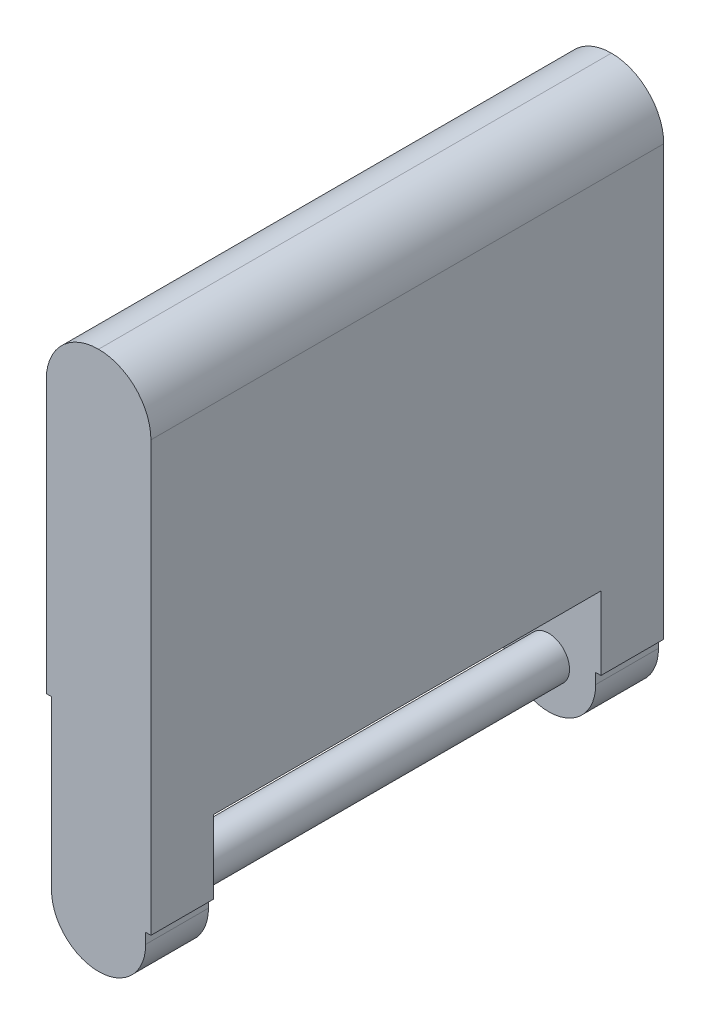
from build123d import *

# Parameters (mm, degrees)
BOSS_EXTRUDE1_DEPTH    = 49
FILLET1_R              = 5
CUT_EXTRUDE1_START     = -2.282608696
CUT_EXTRUDE1_OUTLINE_W = 10
CUT_EXTRUDE1_OUTLINE_H = 37
CUT_EXTRUDE1_DEPTH     = 13
SKETCH6_R              = 2
BOSS_EXTRUDE2_DEPTH    = 37
CUT_EXTRUDE2_DEPTH     = 49


# Read off the part's stored shape, not the designer's step: Cut-Extrude1
with BuildPart() as part:
    # Sketch3 → Boss-Extrude1 (new body)
    with BuildSketch(Plane.XY.offset(24.5)):
        Polygon((-5, -2.282608696), (0, -2.282608696), (5, -2.282608696), (5, 49.717391304), (-5, 49.717391304), align=None)
    extrude(amount=-BOSS_EXTRUDE1_DEPTH)

    # Fillet1
    fillet1_edges = [part.edges().sort_by_distance(p)[0] for p in [
        (5, -2.282608696, 0),
        (-5, -2.282608696, 0),
        (5, 49.717391304, 0),
        (-5, 49.717391304, 0),
    ]]
    fillet(fillet1_edges, radius=FILLET1_R - 0.0001)  # a hair under: the kernel refuses the full size

    # Cut-Extrude1 outline → Cut-Extrude1 (cut)
    with BuildSketch(Plane(origin=(0, 0, 0), x_dir=(1, 0, 0), z_dir=(0, 1, 0)).offset(CUT_EXTRUDE1_START)):
        Rectangle(CUT_EXTRUDE1_OUTLINE_W, CUT_EXTRUDE1_OUTLINE_H)
    extrude(amount=CUT_EXTRUDE1_DEPTH, mode=Mode.SUBTRACT)

    # Sketch6 → Boss-Extrude2 (add)
    with BuildSketch(Plane.XY.offset(-18.5)):
        with Locations((0, 2.717391304)):
            Circle(SKETCH6_R)
    extrude(amount=BOSS_EXTRUDE2_DEPTH)

    # Sketch7 → Cut-Extrude2 (cut)
    with BuildSketch(Plane.XY.offset(24.5)):
        with BuildLine():
            Line((4.5, 3.717391304), (5, 3.717391304))
            Line((5, 3.717391304), (5, 2.717391304))
            ThreePointArc((5, 2.717391304), (3.535533906, -0.818142602), (0, -2.282608696))
            ThreePointArc((0, -2.282608696), (-3.535533906, -0.818142602), (-5, 2.717391304))
            Line((-5, 2.717391304), (-5, 18.717391304))
            Line((-5, 18.717391304), (-4.5, 18.717391304))
            Line((-4.5, 18.717391304), (-4.5, 2.717391304))
            ThreePointArc((-4.5, 2.717391304), (-3.181980515, -0.464589211), (0, -1.782608696))
            ThreePointArc((0, -1.782608696), (3.181980515, -0.464589211), (4.5, 2.717391304))
            Line((4.5, 2.717391304), (4.5, 3.717391304))
        make_face()
    extrude(amount=-CUT_EXTRUDE2_DEPTH, mode=Mode.SUBTRACT)


with BuildPart() as cut_extrude2_kept_piece:
    # of the separate pieces the step leaves, the one the design keeps (cut_extrude2_pieces_kept)
    add(part.part.solids().sort_by_distance((4.5, 3.717391304, -18.5))[0])


solid = cut_extrude2_kept_piece.part
